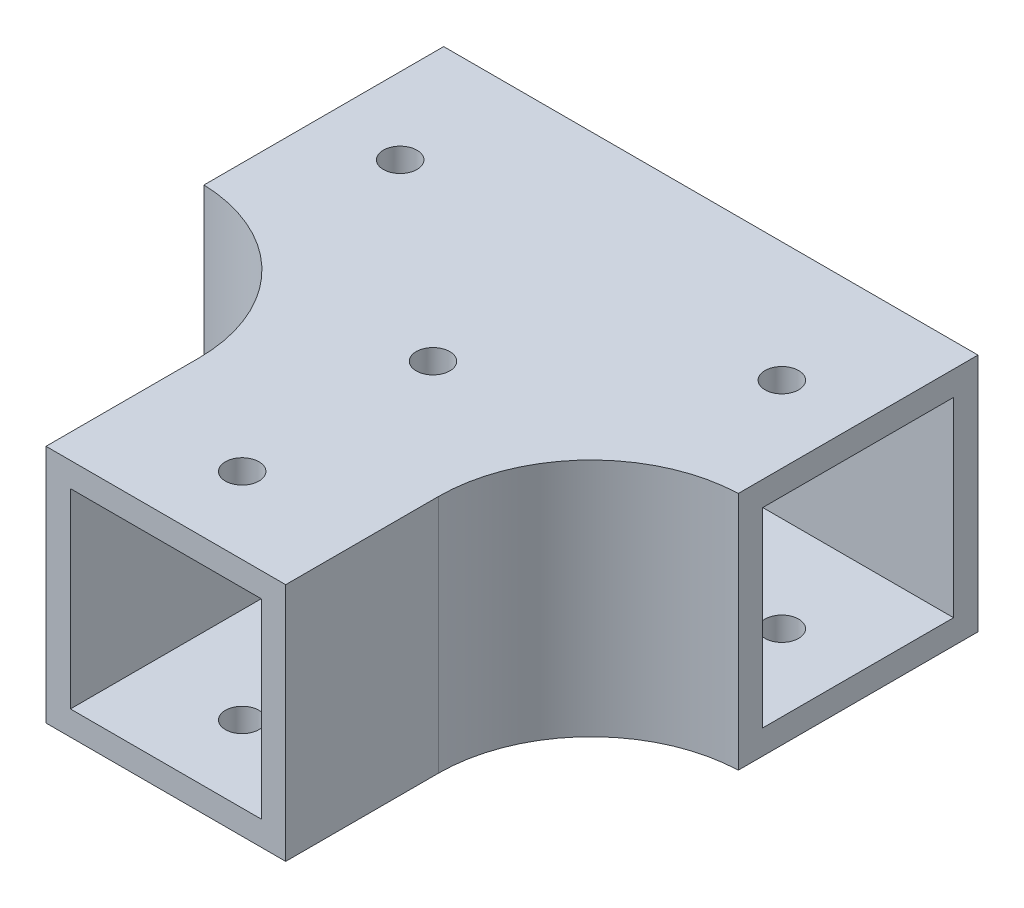
from build123d import *

# Parameters (mm, degrees)
SKETCH_1_W          = 31.4
SKETCH_1_H          = 31.4
SKETCH_1_W_2        = 25
SKETCH_1_H_2        = 25
EXTRUDE_1_DEPTH     = 70
SKETCH_2_W          = 31.4
SKETCH_2_H          = 31.4
SKETCH_2_W_2        = 25
SKETCH_2_H_2        = 25
EXTRUDE_2_DEPTH     = 40
CUT_EXTRUDE_1_REACH = 84.137
SKETCH_3_W          = 25
SKETCH_3_H          = 25
FILLET_1_R          = 20
SKETCH_4_R          = 2.2
CUT_EXTRUDE_2_DEPTH = 95.807436417


with BuildPart() as part:
    # Эскиз1 → Вытянуть-Тонкостенный1 (new body)
    with BuildSketch(Plane(origin=(0, 0, 0), x_dir=(0, 0, -1), z_dir=(1, 0, 0))):
        Rectangle(SKETCH_1_W, SKETCH_1_H)
        Rectangle(SKETCH_1_W_2, SKETCH_1_H_2, mode=Mode.SUBTRACT)
    extrude(amount=EXTRUDE_1_DEPTH)

    # Эскиз2 → Вытянуть-Тонкостенный2 (add)
    with BuildSketch(Plane.XY.offset(15.7)):
        with Locations((35, 0)):
            Rectangle(SKETCH_2_W, SKETCH_2_H)
        with Locations((35, 0)):
            Rectangle(SKETCH_2_W_2, SKETCH_2_H_2, mode=Mode.SUBTRACT)
    extrude(amount=EXTRUDE_2_DEPTH)

    # Эскиз3 → Вырез-Вытянуть1 (cut, up to next)
    with BuildSketch(Plane.XY.offset(15.7), mode=Mode.PRIVATE) as cut_extrude_1_sk1:
        with Locations((35, 0)):
            Rectangle(SKETCH_3_W, SKETCH_3_H)
    cut_extrude_1_tool1 = extrude(cut_extrude_1_sk1.sketch, amount=-CUT_EXTRUDE_1_REACH, mode=Mode.PRIVATE) & part.part
    add(cut_extrude_1_tool1.solids().sort_by_distance((35, 0, 15.7))[0], mode=Mode.SUBTRACT)

    # Скругление1
    # the kernel refuses this fillet: 20 mm, written as the material it adds along each edge
    with BuildSketch(Plane(origin=(50.7, 15.7, 15.7), x_dir=(0, 0, 1), z_dir=(0, -1, 0))) as fillet_1_piece_1:
        with BuildLine():
            CenterArc((19.987746246, -20), FILLET_1_R, 90, 87.994238065)
            Line((0, -19.3), (-0.399754925, -19.286))
            ThreePointArc((-0.399754925, -19.286), (-0.4, -9.65), (-0.4, 0))
            Line((-0.4, 0), (0, 0.4))
            Line((0, 0.4), (19.987746246, 0.4))
            Line((19.987746246, 0.4), (19.987746246, 0))
        make_face()
    extrude(amount=31.4)
    with BuildSketch(Plane(origin=(19.3, -15.7, 15.7), x_dir=(-1, 0, 0), z_dir=(0, 1, 0))) as fillet_1_piece_2:
        with BuildLine():
            CenterArc((20, 19.987746246), FILLET_1_R, 180, 87.994238065)
            Line((0, 19.987746246), (-0.4, 19.987746246))
            Line((-0.4, 19.987746246), (-0.4, 0))
            Line((-0.4, 0), (0, -0.4))
            ThreePointArc((0, -0.4), (9.65, -0.4), (19.286, -0.399754925))
            Line((19.286, -0.399754925), (19.3, 0))
        make_face()
    extrude(amount=31.4)

    # Эскиз4 → Вырез-Вытянуть2 (cut, through all)
    with BuildSketch(Plane(origin=(0, 15.7, 0), x_dir=(1, 0, 0), z_dir=(0, 1, 0))):
        with Locations(Location((10, 0, 0), (0, 0, 270))):
            Circle(SKETCH_4_R)
        with Locations(Location((60, 0, 0), (0, 0, 270))):
            Circle(SKETCH_4_R)
        with Locations(Location((35, -45.7, 0), (0, 0, 270))):
            Circle(SKETCH_4_R)
        with Locations(Location((35, -20.7, 0), (0, 0, 270))):
            Circle(SKETCH_4_R)
    extrude(amount=-CUT_EXTRUDE_2_DEPTH, mode=Mode.SUBTRACT)


solid = part.part
